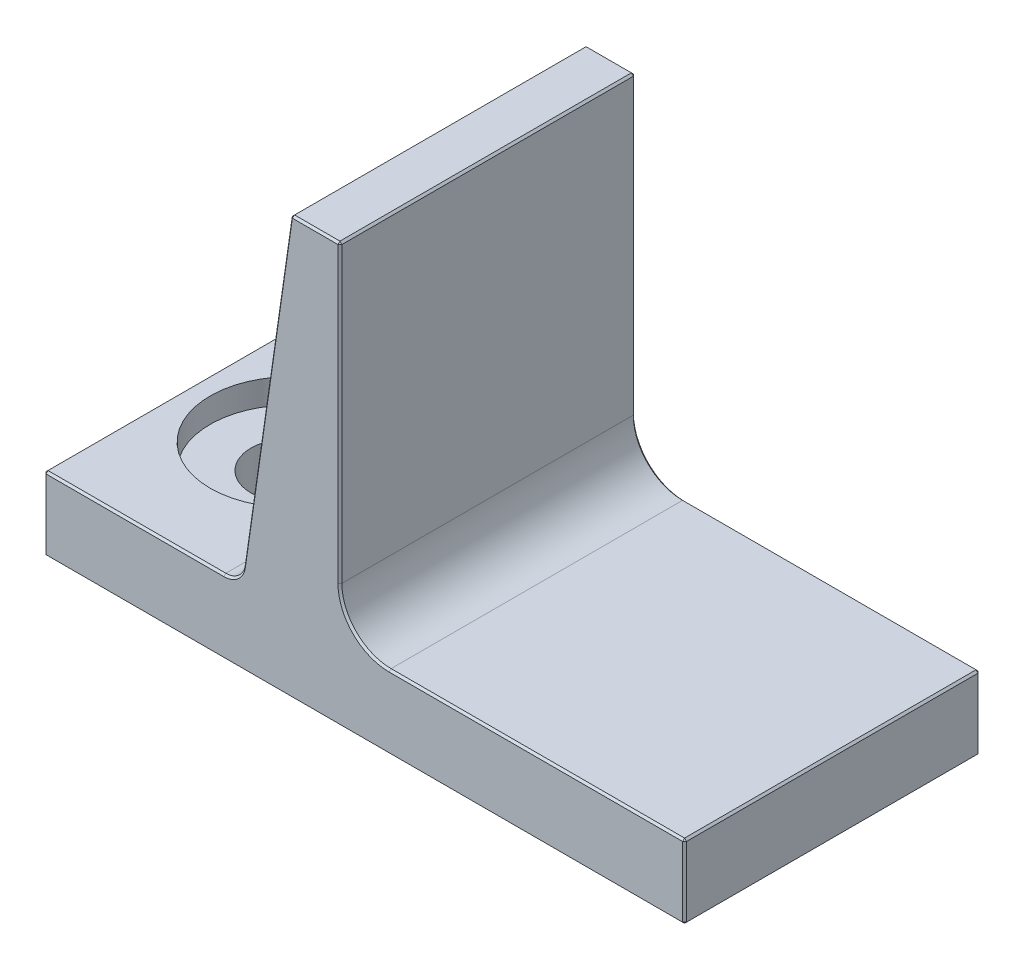
from build123d import *
from OCP.BRepFilletAPI import BRepFilletAPI_MakeChamfer

# Parameters (mm, degrees)
BOSS_EXTRUDE1_DEPTH                                  = 38.1
CBORE_FOR_3_8_BINDING_HEAD_MACHINE_SCREW_D           = 10.0838
CBORE_FOR_3_8_BINDING_HEAD_MACHINE_SCREW_CBORE_D     = 20.6375
CBORE_FOR_3_8_BINDING_HEAD_MACHINE_SCREW_CBORE_DEPTH = 3.175
FILLET1_R                                            = 2.54
FILLET2_R                                            = 6.35
CHAMFER1_SIZE                                        = 0.254
CHAMFER1_SIZE2                                       = 0.299878075


with BuildPart() as part:
    # Sketch1 → Boss-Extrude1 (new body)
    with BuildSketch(Plane.XY):
        Polygon((0, 0), (44.45, 0), (44.45, -9.525), (-38.1608076, -9.525), (-38.1608076, 0), (-12.7608076, 0), (-6.35, 44.45), (0, 44.45), align=None)
    extrude(amount=BOSS_EXTRUDE1_DEPTH)

    # CBORE for 3/8 Binding Head Machine Screw1 (through all)
    with Locations(Plane(origin=(0, 0, 0), x_dir=(1, 0, 0), z_dir=(0, 1, 0))):
        with Locations((-25.4608076, -19.05)):
            CounterBoreHole(CBORE_FOR_3_8_BINDING_HEAD_MACHINE_SCREW_D / 2, CBORE_FOR_3_8_BINDING_HEAD_MACHINE_SCREW_CBORE_D / 2, CBORE_FOR_3_8_BINDING_HEAD_MACHINE_SCREW_CBORE_DEPTH)

    # Fillet1
    fillet1_edges = [part.edges().sort_by_distance(p)[0] for p in [
        (-12.7608076, 0, 19.05),
    ]]
    fillet(fillet1_edges, radius=FILLET1_R)

    # Fillet2
    fillet2_edges = [part.edges().sort_by_distance(p)[0] for p in [
        (0, 0, 19.05),
    ]]
    fillet(fillet2_edges, radius=FILLET2_R)

    # Chamfer1: one chamfer whose edges measure the first distance from different faces: ONE call of the kernel's chamfer builder (chamfer() names one face for all edges)
    chamfer1_edges_1 = [part.edges().sort_by_distance(p)[0] for p in [
        (-6.35, 44.45, 19.05),
    ]]
    chamfer1_side_1 = [part.faces().sort_by_distance(p)[0] for p in [
        (-3.175, 44.45, 19.05),
    ]]
    chamfer1_edges_2 = [part.edges().sort_by_distance(p)[0] for p in [
        (-3.175, 44.45, 0),
        (-3.175, 44.45, 38.1),
        (0, 44.45, 19.05),
        (-9.398384465, 23.313709862, 0),
        (-9.398384465, 23.313709862, 38.1),
        (-13.297830854, 0.620032045, 0),
        (-13.297830854, 0.620032045, 38.1),
        (-26.560782253, 0, 0),
        (-38.1608076, 0, 19.05),
        (-26.560782253, 0, 38.1),
        (-38.1608076, -4.7625, 0),
        (-38.1608076, -9.525, 19.05),
        (-38.1608076, -4.7625, 38.1),
        (3.1445962, -9.525, 0),
        (3.1445962, -9.525, 38.1),
        (44.45, -4.7625, 0),
        (44.45, -4.7625, 38.1),
        (44.45, -9.525, 19.05),
        (44.45, 0, 19.05),
        (25.4, 0, 0),
        (1.859871939, 1.859871939, 0),
        (1.859871939, 1.859871939, 38.1),
        (0, 25.4, 0),
        (0, 25.4, 38.1),
        (25.4, 0, 38.1),
    ]]
    chamfer1 = BRepFilletAPI_MakeChamfer(part.part.solid().wrapped)
    for e in chamfer1_edges_1:
        chamfer1.Add(CHAMFER1_SIZE, CHAMFER1_SIZE2, e.wrapped, chamfer1_side_1[0].wrapped)  # the first distance lies on this face
    for e in chamfer1_edges_2:
        chamfer1.Add(CHAMFER1_SIZE, e.wrapped)
    add(Compound.cast(chamfer1.Shape()), mode=Mode.REPLACE)


solid = part.part
